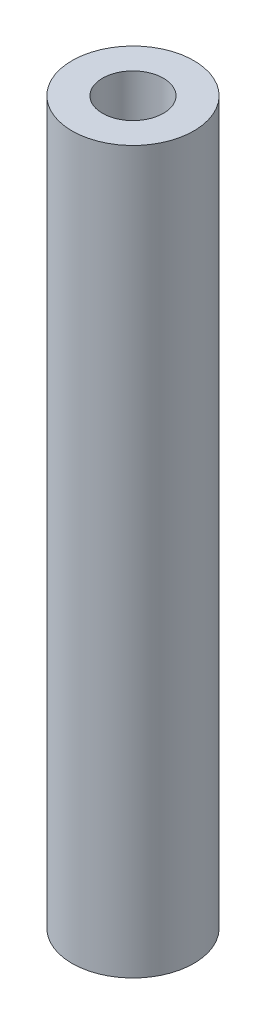
from build123d import *

# Parameters (mm, degrees)
SKETCH1_R      = 3
SKETCH1_R_2    = 1.5
STANDOFF_DEPTH = 35.5


with BuildPart() as part:
    # Sketch1 → standoff (new body)
    with BuildSketch(Plane(origin=(0, 0, 0), x_dir=(1, 0, 0), z_dir=(0, 1, 0))):
        Circle(SKETCH1_R)
        Circle(SKETCH1_R_2, mode=Mode.SUBTRACT)
    extrude(amount=STANDOFF_DEPTH)


solid = part.part
